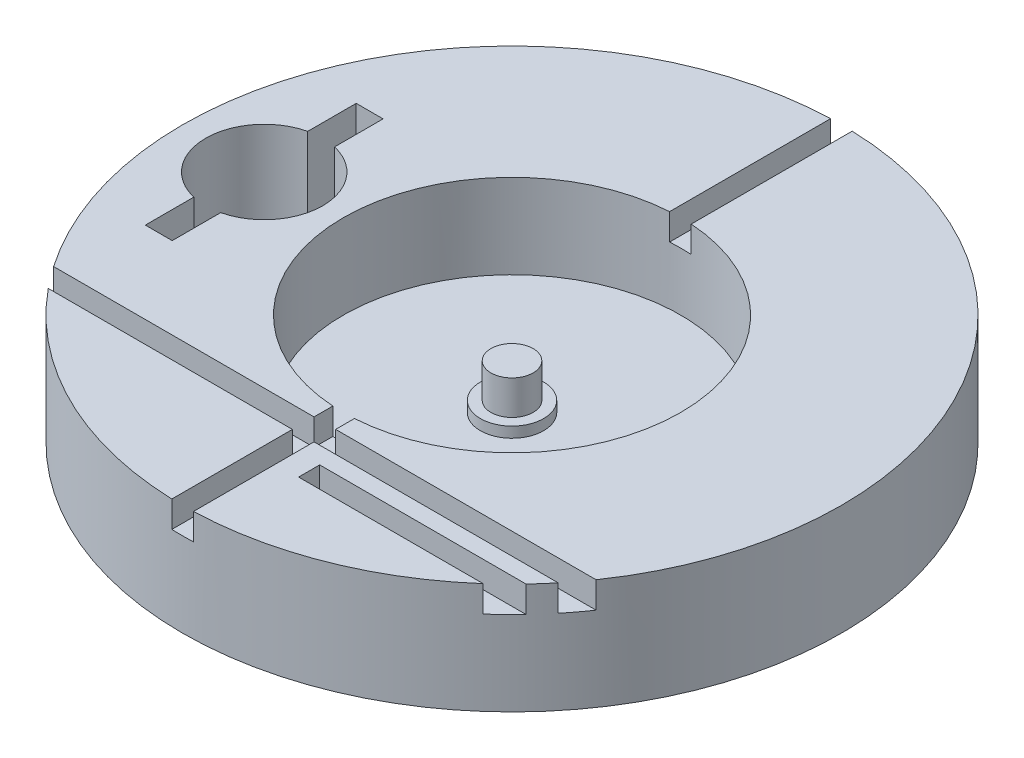
from build123d import *

# Parameters (mm, degrees)
SKETCH1_R           = 62.5
BOSS_EXTRUDE1_DEPTH = 21
SKETCH2_R           = 32
SKETCH2_R_2         = 6
CUT_EXTRUDE1_DEPTH  = 16
SKETCH3_R           = 6
SKETCH3_R_2         = 4
CUT_EXTRUDE2_DEPTH  = 14
SKETCH4_R           = 4
CUT_EXTRUDE3_DEPTH  = 7.5
CUT_EXTRUDE4_START  = -5
CUT_EXTRUDE4_DEPTH  = 5
CUT_EXTRUDE5_START  = -5
CUT_EXTRUDE5_DEPTH  = 5
CUT_EXTRUDE6_START  = -5
CUT_EXTRUDE6_DEPTH  = 5
CUT_EXTRUDE7_DEPTH  = 18.5


with BuildPart() as part:
    # Sketch1 → Boss-Extrude1 (new body)
    with BuildSketch(Plane(origin=(0, 0, 0), x_dir=(1, 0, 0), z_dir=(0, 1, 0))):
        Circle(SKETCH1_R)
    extrude(amount=BOSS_EXTRUDE1_DEPTH)

    # Sketch2 → Cut-Extrude1 (cut)
    with BuildSketch(Plane(origin=(0, 21, 0), x_dir=(1, 0, 0), z_dir=(0, 1, 0))):
        Circle(SKETCH2_R)
        Circle(SKETCH2_R_2, mode=Mode.SUBTRACT)
    extrude(amount=-CUT_EXTRUDE1_DEPTH, mode=Mode.SUBTRACT)

    # Sketch3 → Cut-Extrude2 (cut)
    with BuildSketch(Plane(origin=(0, 21, 0), x_dir=(1, 0, 0), z_dir=(0, 1, 0))):
        Circle(SKETCH3_R)
        Circle(SKETCH3_R_2, mode=Mode.SUBTRACT)
    extrude(amount=-CUT_EXTRUDE2_DEPTH, mode=Mode.SUBTRACT)

    # Sketch4 → Cut-Extrude3 (cut)
    with BuildSketch(Plane(origin=(0, 21, 0), x_dir=(1, 0, 0), z_dir=(0, 1, 0))):
        Circle(SKETCH4_R)
    extrude(amount=-CUT_EXTRUDE3_DEPTH, mode=Mode.SUBTRACT)

    # Sketch5 → Cut-Extrude4 (cut)
    with BuildSketch(Plane(origin=(0, 21, 0), x_dir=(1, 0, 0), z_dir=(0, 1, 0)).offset(CUT_EXTRUDE4_START)):
        with BuildLine():
            Line((2.05, 62.466370953), (2.05, -62.466370953))
            ThreePointArc((2.05, -62.466370953), (0, -62.5), (-2.05, -62.466370953))
            Line((-2.05, -62.466370953), (-2.05, 62.466370953))
            ThreePointArc((-2.05, 62.466370953), (0, 62.5), (2.05, 62.466370953))
        make_face()
    extrude(amount=CUT_EXTRUDE4_DEPTH, mode=Mode.SUBTRACT)

    # Sketch6 → Cut-Extrude5 (cut)
    with BuildSketch(Plane(origin=(0, 21, 0), x_dir=(1, 0, 0), z_dir=(0, 1, 0)).offset(CUT_EXTRUDE5_START)):
        with BuildLine():
            Line((-48.35, -39.60463988), (48.35, -39.60463988))
            ThreePointArc((48.35, -39.60463988), (49.936833573, -37.584074456), (51.439284598, -35.5))
            Line((51.439284598, -35.5), (-51.439284598, -35.5))
            ThreePointArc((-51.439284598, -35.5), (-49.936833573, -37.584074456), (-48.35, -39.60463988))
        make_face()
    extrude(amount=CUT_EXTRUDE5_DEPTH, mode=Mode.SUBTRACT)

    # Sketch9 → Cut-Extrude6 (cut)
    with BuildSketch(Plane(origin=(0, 21, 0), x_dir=(1, 0, 0), z_dir=(0, 1, 0)).offset(CUT_EXTRUDE6_START)):
        with BuildLine():
            Line((45.500273824, -42.848279801), (6.37014237, -42.848279801))
            Line((6.37014237, -42.848279801), (6.37014237, -46.848279801))
            Line((6.37014237, -46.848279801), (41.37014237, -46.848279801))
            ThreePointArc((41.37014237, -46.848279801), (43.481229311, -44.895798217), (45.500273824, -42.848279801))
        make_face()
    extrude(amount=CUT_EXTRUDE6_DEPTH, mode=Mode.SUBTRACT)

    # Sketch10 → Cut-Extrude7 (cut)
    with BuildSketch(Plane(origin=(0, 21, 0), x_dir=(1, 0, 0), z_dir=(0, 1, 0))):
        with BuildLine():
            Line((-49.55, 10.803124548), (-49.55, 20))
            Line((-49.55, 20), (-44.45, 20))
            Line((-44.45, 20), (-44.45, 10.803124548))
            ThreePointArc((-44.45, 10.803124548), (-35.9, 0), (-44.45, -10.803124548))
            Line((-44.45, -10.803124548), (-44.45, -20))
            Line((-44.45, -20), (-49.55, -20))
            Line((-49.55, -20), (-49.55, -10.803124548))
            ThreePointArc((-49.55, -10.803124548), (-58.1, 0), (-49.55, 10.803124548))
        make_face()
    extrude(amount=-CUT_EXTRUDE7_DEPTH, mode=Mode.SUBTRACT)


solid = part.part
